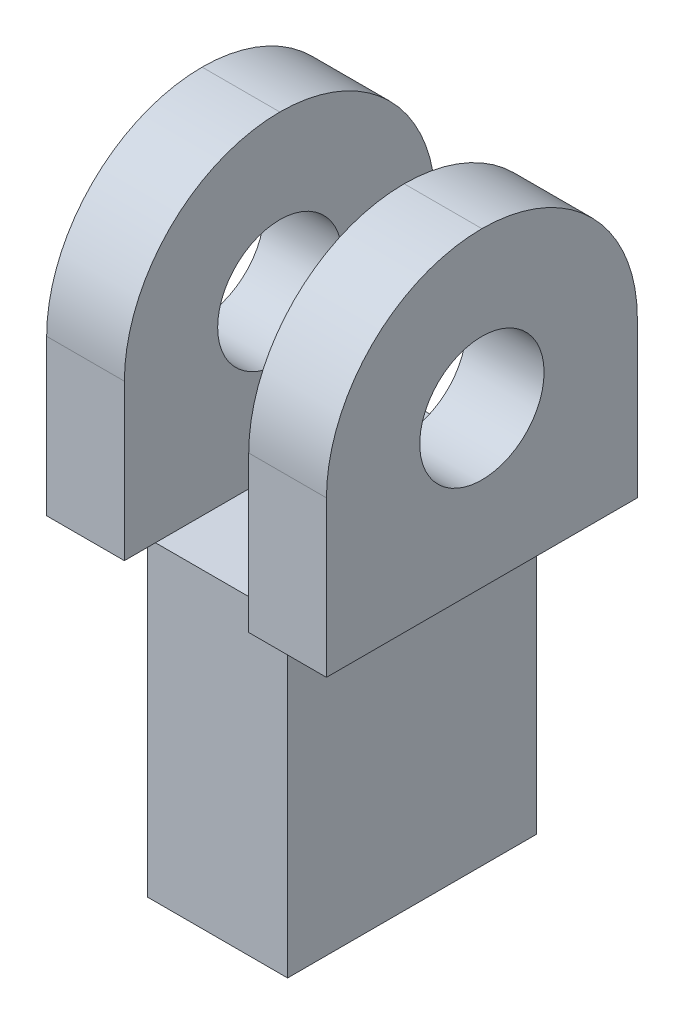
from build123d import *

# Parameters (mm, degrees)
SKETCH1_W           = 9
SKETCH1_H           = 16
BOSS_EXTRUDE1_DEPTH = 20
SKETCH2_W           = 8.2
SKETCH2_H           = 15.2
CUT_EXTRUDE1_DEPTH  = 18
SKETCH4_W           = 5
SKETCH4_H           = 20
BOSS_EXTRUDE2_DEPTH = 20
SKETCH5_R           = 4
CUT_EXTRUDE2_DEPTH  = 45.988887517
FILLET1_R           = 10


with BuildPart() as part:
    # Sketch1 → Boss-Extrude1 (new body)
    with BuildSketch(Plane(origin=(0, 0, 0), x_dir=(1, 0, 0), z_dir=(0, 1, 0))):
        Rectangle(SKETCH1_W, SKETCH1_H)
    extrude(amount=BOSS_EXTRUDE1_DEPTH)

    # Sketch2 → Cut-Extrude1 (cut)
    with BuildSketch(Plane.XZ):
        Rectangle(SKETCH2_W, SKETCH2_H)
    extrude(amount=-CUT_EXTRUDE1_DEPTH, mode=Mode.SUBTRACT)

    # Sketch4 → Boss-Extrude2 (add)
    with BuildSketch(Plane(origin=(0, 20, 0), x_dir=(1, 0, 0), z_dir=(0, 1, 0))):
        with Locations((6.5, 0)):
            Rectangle(SKETCH4_W, SKETCH4_H)
        with Locations((-6.5, 0)):
            Rectangle(SKETCH4_W, SKETCH4_H)
    extrude(amount=BOSS_EXTRUDE2_DEPTH)

    # Sketch5 → Cut-Extrude2 (cut, through all)
    with BuildSketch(Plane(origin=(9, 0, 0), x_dir=(0, 0, -1), z_dir=(1, 0, 0))):
        with Locations((0, 30)):
            Circle(SKETCH5_R)
    extrude(amount=-CUT_EXTRUDE2_DEPTH, mode=Mode.SUBTRACT)

    # Fillet1
    fillet1_edges = [part.edges().sort_by_distance(p)[0] for p in [
        (6.5, 40, 10),
        (6.5, 40, -10),
        (-6.5, 40, -10),
        (-6.5, 40, 10),
    ]]
    fillet(fillet1_edges, radius=FILLET1_R - 0.0001)  # a hair under: the kernel refuses the full size


solid = part.part
